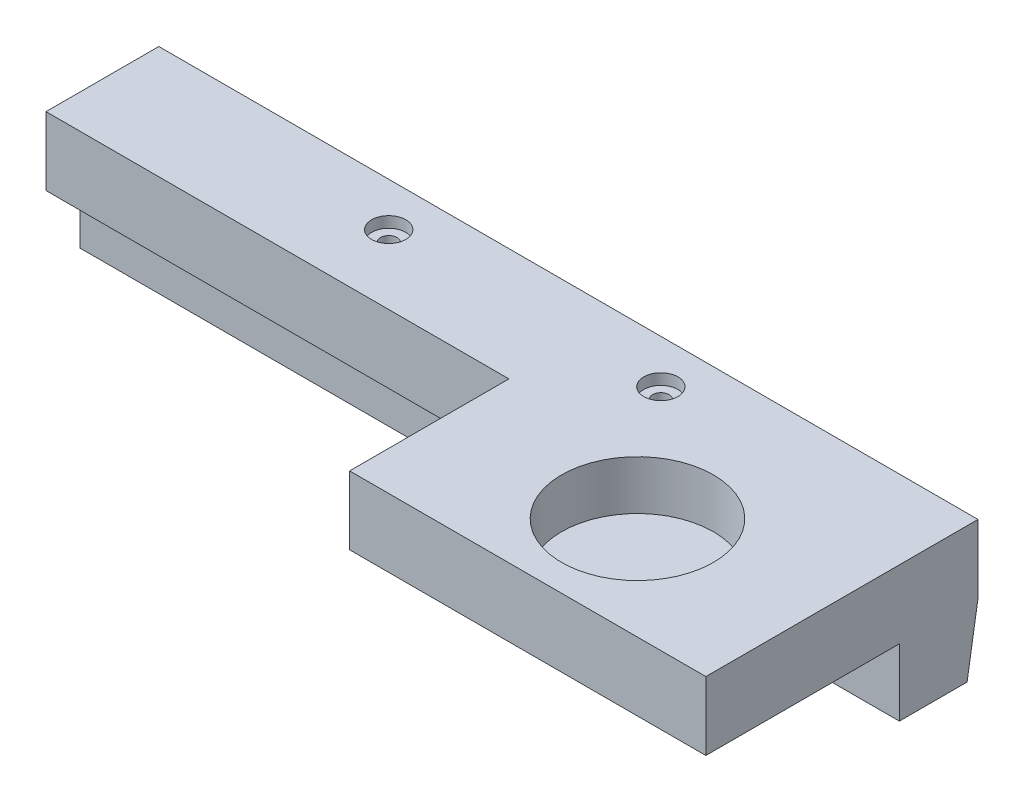
from build123d import *

# Parameters (mm, degrees)
SZKIC1_W                                             = 119.8
SZKIC1_H                                             = 10
DODANIE_WYCI_GNI_CIE2_DEPTH                          = 38.3
SZKIC21_W                                            = 119.8
SZKIC21_H                                            = 10
DODANIE_WYCI_GNI_CIE3_DEPTH                          = 9.8
POG_BIENIE_WALCOWE_POD_M2_WKR_T_DO_CZ_CI_D           = 2.4
POG_BIENIE_WALCOWE_POD_M2_WKR_T_DO_CZ_CI_CBORE_D     = 5
POG_BIENIE_WALCOWE_POD_M2_WKR_T_DO_CZ_CI_CBORE_DEPTH = 1.6
SZKIC28_R                                            = 11.1
WYTNIJ_WYCI_GNI_CIE1_DEPTH                           = 7.2
WYTNIJ_WYCI_GNI_CIE4_DEPTH                           = 124.8
DODANIE_WYCI_GNI_CIE5_DEPTH                          = 119.8
SZKIC34_W                                            = 119.8
SZKIC34_H                                            = 10
DODANIE_WYCI_GNI_CIE6_DEPTH                          = 1.5
SZKIC38_W                                            = 67.7
SZKIC38_H                                            = 10
WYTNIJ_WYCI_GNI_CIE5_DEPTH                           = 23.3


with BuildPart() as part:
    # Szkic1 → Dodanie-wyciągnięcie2 (new body)
    with BuildSketch(Plane.XY):
        with Locations((1.59336777, 27.024849398)):
            Rectangle(SZKIC1_W, SZKIC1_H)
    extrude(amount=DODANIE_WYCI_GNI_CIE2_DEPTH)

    # Szkic21 → Dodanie-wyciągnięcie3 (add)
    with BuildSketch(Plane(origin=(0, 32.024849398, 0), x_dir=(1, 0, 0), z_dir=(0, 1, 0))):
        with Locations((1.59336777, -5)):
            Rectangle(SZKIC21_W, SZKIC21_H)
    extrude(amount=DODANIE_WYCI_GNI_CIE3_DEPTH)

    # Pogłębienie walcowe pod M2 wkręt do części metalowych z łbem stożkowym ściętym2 (through all)
    with Locations(Plane(origin=(0, 22.024849398, 0), x_dir=(-1, 0, 0), z_dir=(0, -1, 0))):
        with Locations((-21.49336777, -4.88), (18.30663223, -4.88)):
            CounterBoreHole(POG_BIENIE_WALCOWE_POD_M2_WKR_T_DO_CZ_CI_D / 2, POG_BIENIE_WALCOWE_POD_M2_WKR_T_DO_CZ_CI_CBORE_D / 2, POG_BIENIE_WALCOWE_POD_M2_WKR_T_DO_CZ_CI_CBORE_DEPTH)

    # Szkic28 → Wytnij-wyciągnięcie1 (cut)
    with BuildSketch(Plane.XZ.offset(-22.024849398)):
        with Locations((36.49336777, 23.3)):
            Circle(SZKIC28_R)
    extrude(amount=-WYTNIJ_WYCI_GNI_CIE1_DEPTH, mode=Mode.SUBTRACT)

    # Szkic31 → Wytnij-wyciągnięcie4 (cut)
    with BuildSketch(Plane(origin=(61.49336777, 0, 0), x_dir=(0, 0, -1), z_dir=(1, 0, 0))):
        Polygon((0, 41.824849398), (-0.096491228, 41.824849398), (0, 41.232541705), align=None)
    extrude(amount=-WYTNIJ_WYCI_GNI_CIE4_DEPTH, mode=Mode.SUBTRACT)

    # Szkic31<5> → Dodanie-wyciągnięcie5 (add)
    with BuildSketch(Plane(origin=(61.49336777, 0, 0), x_dir=(0, 0, -1), z_dir=(1, 0, 0))):
        Polygon((0, 41.232541705), (0, 32.024849398), (1.5, 32.024849398), (0.275236278, 39.543014399), align=None)
    extrude(amount=-DODANIE_WYCI_GNI_CIE5_DEPTH)

    # Szkic34 → Dodanie-wyciągnięcie6 (add)
    with BuildSketch(Plane(origin=(0, 0, 0), x_dir=(-1, 0, 0), z_dir=(0, 0, -1))):
        with Locations((-1.59336777, 27.024849398)):
            Rectangle(SZKIC34_W, SZKIC34_H)
    extrude(amount=DODANIE_WYCI_GNI_CIE6_DEPTH)


with BuildPart() as body_2:
    # Lustro2: mirrored copy
    add(part.part.mirror(Plane(origin=(-58.30663223, 22.024849398, 38.3), x_dir=(0, 0, 1), z_dir=(0, 1, 0))))


with BuildPart() as body_2_1:
    # Obiekt-Przenieś/Kopiuj1: moved
    add(body_2.part.moved(Location((0, -36.76628261, 0))))

    # Szkic38 → Wytnij-wyciągnięcie5 (cut)
    with BuildSketch(Plane.XY.offset(38.3)):
        with Locations((-24.45663223, -19.741433212)):
            Rectangle(SZKIC38_W, SZKIC38_H)
    extrude(amount=-WYTNIJ_WYCI_GNI_CIE5_DEPTH, mode=Mode.SUBTRACT)


solid = body_2_1.part
